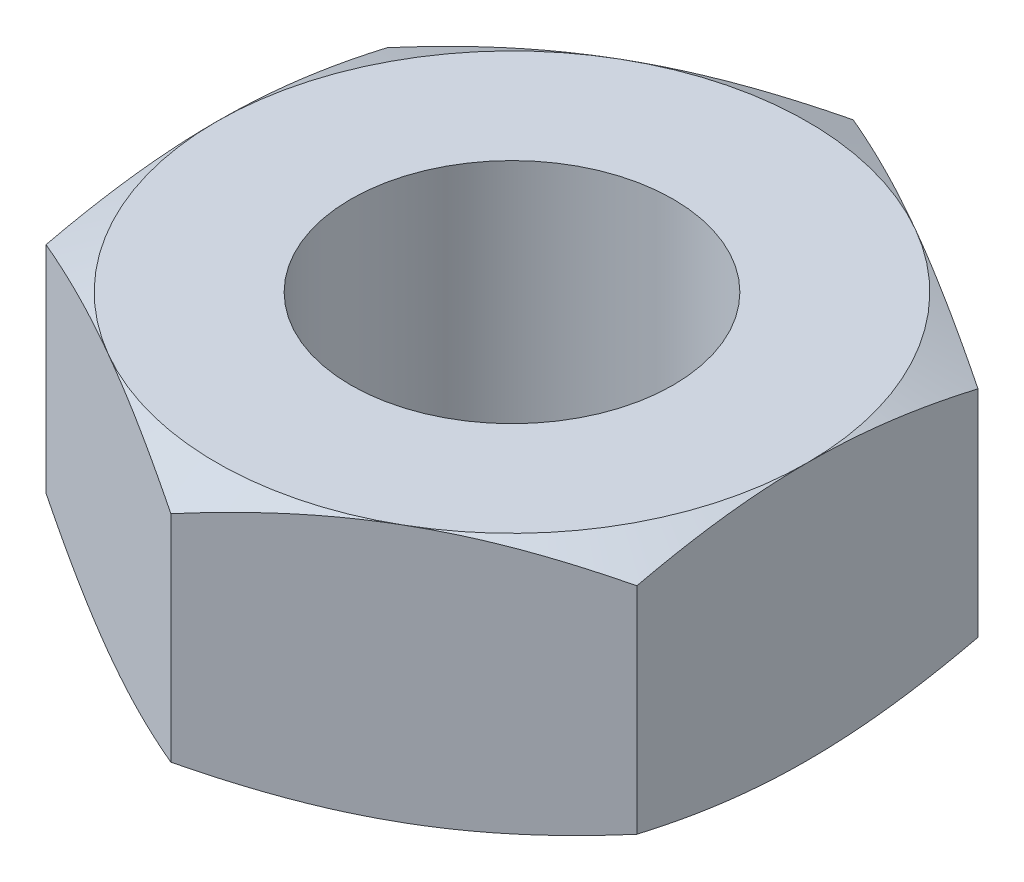
from build123d import *

# Parameters (mm, degrees)
EXTRUDE1_DEPTH = 1.2
SKETCH2_W      = 1.5
SKETCH2_H      = 2.4


with BuildPart() as part:
    # Sketch1 → Extrude1 (new, symmetric)
    with BuildSketch(Plane(origin=(0, 0, 0), x_dir=(1, 0, 0), z_dir=(0, 1, 0))):
        Polygon((0, 3.175426481), (-2.75, 1.58771324), (-2.75, -1.58771324), (0, -3.175426481), (2.75, -1.58771324), (2.75, 1.58771324), align=None)
    extrude(amount=EXTRUDE1_DEPTH, both=True)

    # Sketch4 → Cut-Revolve2 (revolve, cut)
    with BuildSketch(Plane(origin=(0, 0, 0), x_dir=(0, 0, -1), z_dir=(1, 0, 0))):
        Polygon((0, 1.2), (1.5, 1.2), (1.269011592, 1.092288336), (1.269011592, -1.092288336), (1.5, -1.2), (0, -1.2), align=None)
    revolve(axis=Axis((0, 1.2, 0), (0, 1, 0)), mode=Mode.SUBTRACT)


with BuildPart() as body_2:
    # Sketch2 → Revolve1 (revolve)
    with BuildSketch(Plane(origin=(0, 0, 0), x_dir=(0, 0, -1), z_dir=(1, 0, 0))):
        with Locations((0.75, 0)):
            Rectangle(SKETCH2_W, SKETCH2_H)
    revolve(axis=Axis((0, -2.7, 0), (0, 1, 0)))


with BuildPart() as part_1:
    add(part.part)

    # Combine1: cut body 2
    add(body_2.part, mode=Mode.SUBTRACT)

    # Sketch5 → Cut-Revolve3 (revolve, cut)
    with BuildSketch(Plane(origin=(0, 0, 0), x_dir=(0, 0, -1), z_dir=(1, 0, 0))):
        Polygon((0, -1.2), (2.75, -1.2), (3.175426481, -1.001620374), (3.175426481, 1.001620374), (2.75, 1.2), (0, 1.2), (0, 2.47), (4.445426481, 2.47), (4.445426481, -2.47), (0, -2.47), align=None)
    revolve(axis=Axis((0, -1.2, 0), (0, 1, 0)), mode=Mode.SUBTRACT)


solid = part_1.part
